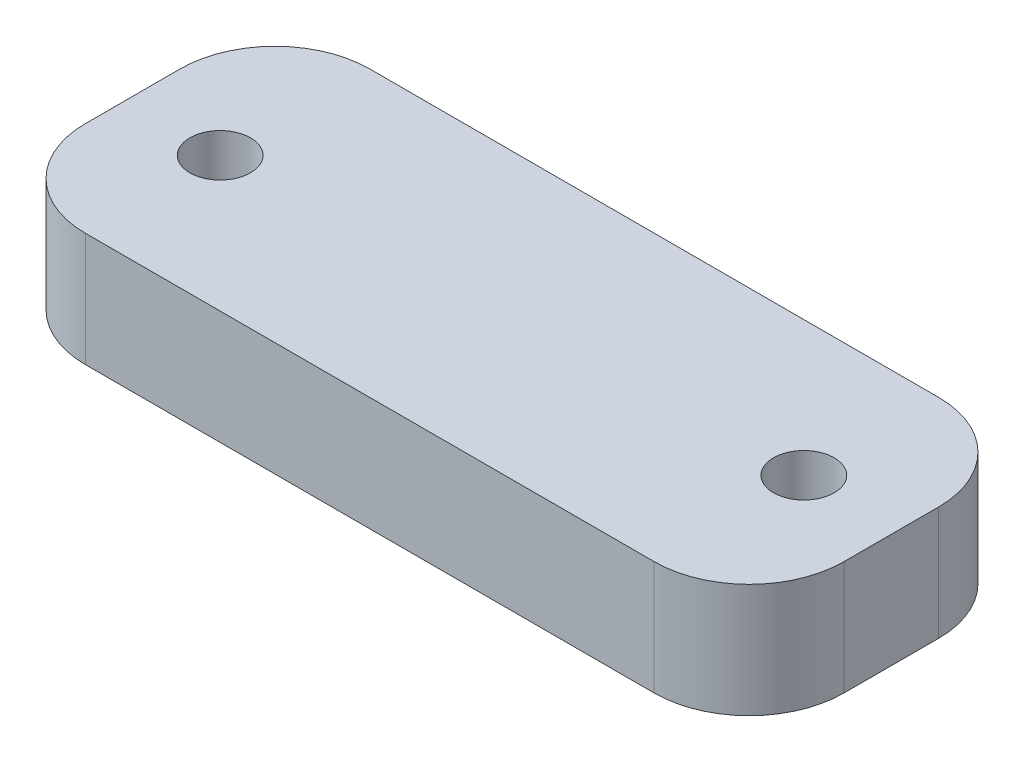
from build123d import *

# Parameters (mm, degrees)
SKETCH1_W            = 40
SKETCH1_H            = 15
BOSS_EXTRUDE1_DEPTH  = 6
M3_CLEARANCE_HOLE1_D = 3.2
FILLET1_R            = 5


with BuildPart() as part:
    # Sketch1 → Boss-Extrude1 (new body)
    with BuildSketch(Plane(origin=(0, 0, 0), x_dir=(1, 0, 0), z_dir=(0, 1, 0))):
        Rectangle(SKETCH1_W, SKETCH1_H)
    extrude(amount=BOSS_EXTRUDE1_DEPTH)

    # M3 Clearance Hole1 (through all)
    with Locations(Plane(origin=(0, 6, 0), x_dir=(1, 0, 0), z_dir=(0, 1, 0))):
        with Locations((-15, -0.388592116), (15, 0.388592116)):
            Hole(M3_CLEARANCE_HOLE1_D / 2)

    # Fillet1
    fillet1_edges = [part.edges().sort_by_distance(p)[0] for p in [
        (20, 3, 7.5),
        (-20, 3, -7.5),
        (20, 3, -7.5),
        (-20, 3, 7.5),
    ]]
    fillet(fillet1_edges, radius=FILLET1_R)


solid = part.part
